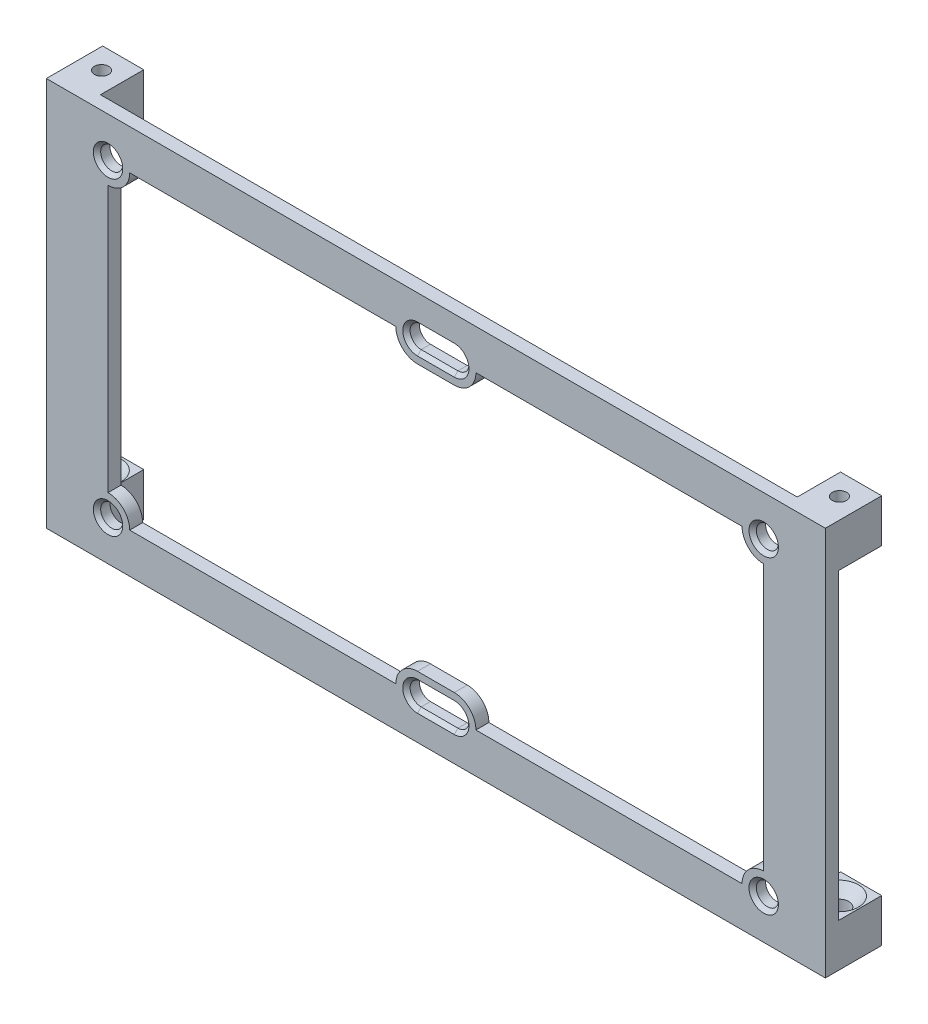
from build123d import *

# Parameters (mm, degrees)
SKETCH3_W                                      = 180
SKETCH3_H                                      = 90
BOSS_EXTRUDE3_DEPTH                            = 3
SKETCH4_W                                      = 8.5
SKETCH4_H                                      = 61.5
CUT_EXTRUDE1_DEPTH                             = 3
CSK_FOR_M5_FLAT_HEAD_MACHINE_SCREW1_AT_2_COUNT = 2
CSK_FOR_M5_FLAT_HEAD_MACHINE_SCREW1_AT_2_PITCH = 167.524625056
CSK_FOR_M5_FLAT_HEAD_MACHINE_SCREW1_AT_3_COUNT = 2
CSK_FOR_M5_FLAT_HEAD_MACHINE_SCREW1_AT_3_PITCH = 71.5
CSK_FOR_M5_FLAT_HEAD_MACHINE_SCREW1_AT_4_COUNT = 2
CSK_FOR_M5_FLAT_HEAD_MACHINE_SCREW1_AT_4_PITCH = 151.5
CSK_SLOT_FOR_M5_FLAT_HEAD_MACHINE_SCREW1_DEPTH = 3
SKETCH12_W                                     = 9.5
SKETCH12_H                                     = 10
BOSS_EXTRUDE4_DEPTH                            = 10
CSK_FOR_M4_SFHCS1_D                            = 4.5
CSK_FOR_M4_SFHCS1_DEPTH                        = 10
CSK_FOR_M4_SFHCS1_CSINK_D                      = 8.96
CSK_FOR_M4_SFHCS1_CSINK_ANGLE                  = 90
M4X0_7_TAPPED_HOLE1_D                          = 3.3


with BuildPart() as part:
    # Sketch3 → Boss-Extrude3 (new body)
    with BuildSketch(Plane.XY):
        Rectangle(SKETCH3_W, SKETCH3_H)
    extrude(amount=BOSS_EXTRUDE3_DEPTH)

    # Sketch4 → Cut-Extrude1 (cut)
    with BuildSketch(Plane.XY.offset(3)):
        with BuildLine():
            Line((-4.25, -30.75), (-4.25, 30.75))
            ThreePointArc((-4.25, 30.75), (-7.785533906, 32.214466094), (-9.25, 35.75))
            Line((-9.25, 35.75), (-70.75, 35.75))
            ThreePointArc((-70.75, 35.75), (-72.214466094, 32.214466094), (-75.75, 30.75))
            Line((-75.75, 30.75), (-75.75, -30.75))
            ThreePointArc((-75.75, -30.75), (-72.214466094, -32.214466094), (-70.75, -35.75))
            Line((-70.75, -35.75), (-9.25, -35.75))
            ThreePointArc((-9.25, -35.75), (-7.785533906, -32.214466094), (-4.25, -30.75))
        make_face()
        Rectangle(SKETCH4_W, SKETCH4_H)
        with BuildLine():
            ThreePointArc((9.25, 35.75), (7.785533906, 32.214466094), (4.25, 30.75))
            Line((4.25, 30.75), (4.25, -30.75))
            ThreePointArc((4.25, -30.75), (7.785533906, -32.214466094), (9.25, -35.75))
            Line((9.25, -35.75), (70.75, -35.75))
            ThreePointArc((70.75, -35.75), (72.214466094, -32.214466094), (75.75, -30.75))
            Line((75.75, -30.75), (75.75, 30.75))
            ThreePointArc((75.75, 30.75), (72.214466094, 32.214466094), (70.75, 35.75))
            Line((70.75, 35.75), (9.25, 35.75))
        make_face()
    extrude(amount=-CUT_EXTRUDE1_DEPTH, mode=Mode.SUBTRACT)

    # Sketch8 → CSK for M5 Flat Head Machine Screw1 (revolve, cut)
    with BuildSketch(Plane(origin=(-75.75, 35.75, 3), x_dir=(0, -1, 0), z_dir=(1, 0, 0))):
        Polygon((0, 0), (0, 3), (2.55, 3), (2.55, 0.85), (3.4, 0), align=None)
    csk_for_m5_flat_head_machine_screw1 = revolve(axis=Axis((-75.75, 35.75, 9.35), (0, 0, -1)), mode=Mode.SUBTRACT)

    # CSK for M5 Flat Head Machine Screw1 at 2: CSK for M5 Flat Head Machine Screw1 ×2
    with Locations(*[Vector(0.9043446594777974, -0.4268029251000826, 0) * (i * CSK_FOR_M5_FLAT_HEAD_MACHINE_SCREW1_AT_2_PITCH) for i in range(1, CSK_FOR_M5_FLAT_HEAD_MACHINE_SCREW1_AT_2_COUNT)]):
        add(csk_for_m5_flat_head_machine_screw1, mode=Mode.SUBTRACT)

    # CSK for M5 Flat Head Machine Screw1 at 3: CSK for M5 Flat Head Machine Screw1 ×2
    with Locations(*[(0, -i * CSK_FOR_M5_FLAT_HEAD_MACHINE_SCREW1_AT_3_PITCH, 0) for i in range(1, CSK_FOR_M5_FLAT_HEAD_MACHINE_SCREW1_AT_3_COUNT)]):
        add(csk_for_m5_flat_head_machine_screw1, mode=Mode.SUBTRACT)

    # CSK for M5 Flat Head Machine Screw1 at 4: CSK for M5 Flat Head Machine Screw1 ×2
    with Locations(*[(i * CSK_FOR_M5_FLAT_HEAD_MACHINE_SCREW1_AT_4_PITCH, 0, 0) for i in range(1, CSK_FOR_M5_FLAT_HEAD_MACHINE_SCREW1_AT_4_COUNT)]):
        add(csk_for_m5_flat_head_machine_screw1, mode=Mode.SUBTRACT)

    # CSK SLOT for M5 Flat Head Machine Screw1: read off the stored shape, not the designer's step
    # CSK SLOT for M5 Flat Head Machine Sc 2 → CSK SLOT for M5 Flat Head Machine Screw1 (cut)
    with BuildSketch(Plane.XY):
        with BuildLine():
            Line((-4.25, 33.2), (4.25, 33.2))
            ThreePointArc((4.25, 33.2), (6.8, 35.75), (4.25, 38.3))
            Line((4.25, 38.3), (-4.25, 38.3))
            ThreePointArc((-4.25, 38.3), (-6.8, 35.75), (-4.25, 33.2))
        make_face()
        with BuildLine():
            Line((-4.25, -38.3), (4.25, -38.3))
            ThreePointArc((4.25, -38.3), (6.8, -35.75), (4.25, -33.2))
            Line((4.25, -33.2), (-4.25, -33.2))
            ThreePointArc((-4.25, -33.2), (-6.8, -35.75), (-4.25, -38.3))
        make_face()
    extrude(amount=CSK_SLOT_FOR_M5_FLAT_HEAD_MACHINE_SCREW1_DEPTH, mode=Mode.SUBTRACT)

    # CSK SLOT for M5 Flat Head Machine Sc 3: loft between two sections, ruled curve by curve
    csk_slot_for_m5_flat_head_machine_sc_3_from = [
        Edge.make_three_point_arc((4.25, 33.2, 2.15), (6.053122292, 33.946877708, 2.15), (6.8, 35.75, 2.15)),
        Edge.make_three_point_arc((6.8, 35.75, 2.15), (6.053122292, 37.553122292, 2.15), (4.25, 38.3, 2.15)),
        Edge.make_three_point_arc((-4.25, 38.3, 2.15), (-6.053122292, 37.553122292, 2.15), (-6.8, 35.75, 2.15)),
        Edge.make_three_point_arc((-6.8, 35.75, 2.15), (-6.053122292, 33.946877708, 2.15), (-4.25, 33.2, 2.15)),
        Edge.make_line((4.25, 38.3, 2.15), (-4.25, 38.3, 2.15)),
        Edge.make_line((4.25, 33.2, 2.15), (-4.25, 33.2, 2.15)),
    ]
    csk_slot_for_m5_flat_head_machine_sc_3_to = [
        Edge.make_three_point_arc((4.25, 32.35, 3), (6.654163056, 33.345836944, 3), (7.65, 35.75, 3)),
        Edge.make_three_point_arc((7.65, 35.75, 3), (6.654163056, 38.154163056, 3), (4.25, 39.15, 3)),
        Edge.make_three_point_arc((-4.25, 39.15, 3), (-6.654163056, 38.154163056, 3), (-7.65, 35.75, 3)),
        Edge.make_three_point_arc((-7.65, 35.75, 3), (-6.654163056, 33.345836944, 3), (-4.25, 32.35, 3)),
        Edge.make_line((4.25, 39.15, 3), (-4.25, 39.15, 3)),
        Edge.make_line((4.25, 32.35, 3), (-4.25, 32.35, 3)),
    ]
    csk_slot_for_m5_flat_head_machine_sc_3 = Solid(Shell([*[Face.make_surface_from_curves(csk_slot_for_m5_flat_head_machine_sc_3_from[k], csk_slot_for_m5_flat_head_machine_sc_3_to[k]) for k in range(6)], Face(Wire(csk_slot_for_m5_flat_head_machine_sc_3_from)), Face(Wire(csk_slot_for_m5_flat_head_machine_sc_3_to))]))
    add(csk_slot_for_m5_flat_head_machine_sc_3, mode=Mode.SUBTRACT)

    # CSK SLOT for M5 Flat Head Machine Sc 4: loft between two sections, ruled curve by curve
    csk_slot_for_m5_flat_head_machine_sc_4_from = [
        Edge.make_three_point_arc((4.25, -38.3, 2.15), (6.053122292, -37.553122292, 2.15), (6.8, -35.75, 2.15)),
        Edge.make_three_point_arc((6.8, -35.75, 2.15), (6.053122292, -33.946877708, 2.15), (4.25, -33.2, 2.15)),
        Edge.make_three_point_arc((-4.25, -33.2, 2.15), (-6.053122292, -33.946877708, 2.15), (-6.8, -35.75, 2.15)),
        Edge.make_three_point_arc((-6.8, -35.75, 2.15), (-6.053122292, -37.553122292, 2.15), (-4.25, -38.3, 2.15)),
        Edge.make_line((4.25, -33.2, 2.15), (-4.25, -33.2, 2.15)),
        Edge.make_line((4.25, -38.3, 2.15), (-4.25, -38.3, 2.15)),
    ]
    csk_slot_for_m5_flat_head_machine_sc_4_to = [
        Edge.make_three_point_arc((4.25, -39.15, 3), (6.654163056, -38.154163056, 3), (7.65, -35.75, 3)),
        Edge.make_three_point_arc((7.65, -35.75, 3), (6.654163056, -33.345836944, 3), (4.25, -32.35, 3)),
        Edge.make_three_point_arc((-4.25, -32.35, 3), (-6.654163056, -33.345836944, 3), (-7.65, -35.75, 3)),
        Edge.make_three_point_arc((-7.65, -35.75, 3), (-6.654163056, -38.154163056, 3), (-4.25, -39.15, 3)),
        Edge.make_line((4.25, -32.35, 3), (-4.25, -32.35, 3)),
        Edge.make_line((4.25, -39.15, 3), (-4.25, -39.15, 3)),
    ]
    csk_slot_for_m5_flat_head_machine_sc_4 = Solid(Shell([*[Face.make_surface_from_curves(csk_slot_for_m5_flat_head_machine_sc_4_from[k], csk_slot_for_m5_flat_head_machine_sc_4_to[k]) for k in range(6)], Face(Wire(csk_slot_for_m5_flat_head_machine_sc_4_from)), Face(Wire(csk_slot_for_m5_flat_head_machine_sc_4_to))]))
    add(csk_slot_for_m5_flat_head_machine_sc_4, mode=Mode.SUBTRACT)

    # Sketch12 → Boss-Extrude4 (add)
    with BuildSketch(Plane(origin=(0, 0, 0), x_dir=(-1, 0, 0), z_dir=(0, 0, -1))):
        with Locations((-85.25, 40)):
            Rectangle(SKETCH12_W, SKETCH12_H)
        with Locations((-85.25, -40)):
            Rectangle(SKETCH12_W, SKETCH12_H)
    boss_extrude4 = extrude(amount=BOSS_EXTRUDE4_DEPTH)

    # CSK for M4 SFHCS1
    with Locations(Plane(origin=(0, -35, 0), x_dir=(1, 0, 0), z_dir=(0, 1, 0))):
        with Locations((85.162636167, 5)):
            csk_for_m4_sfhcs1 = CounterSinkHole(CSK_FOR_M4_SFHCS1_D / 2, CSK_FOR_M4_SFHCS1_CSINK_D / 2, depth=CSK_FOR_M4_SFHCS1_DEPTH, counter_sink_angle=CSK_FOR_M4_SFHCS1_CSINK_ANGLE)

    # M4x0.7 Tapped Hole1 (through all)
    with Locations(Plane(origin=(0, 45, 0), x_dir=(1, 0, 0), z_dir=(0, 1, 0))):
        with Locations((85.25, 5)):
            m4x0_7_tapped_hole1 = Hole(M4X0_7_TAPPED_HOLE1_D / 2)

    # Mirror1: Boss-Extrude4, CSK for M4 SFHCS1, M4x0.7 Tapped Hole1 across plane
    add(boss_extrude4.mirror(Plane(origin=(0, 0, 0), x_dir=(0, 0, 1), z_dir=(1, 0, 0))))
    add(csk_for_m4_sfhcs1.mirror(Plane(origin=(0, 0, 0), x_dir=(0, 0, 1), z_dir=(1, 0, 0))), mode=Mode.SUBTRACT)
    add(m4x0_7_tapped_hole1.mirror(Plane(origin=(0, 0, 0), x_dir=(0, 0, 1), z_dir=(1, 0, 0))), mode=Mode.SUBTRACT)


solid = part.part
